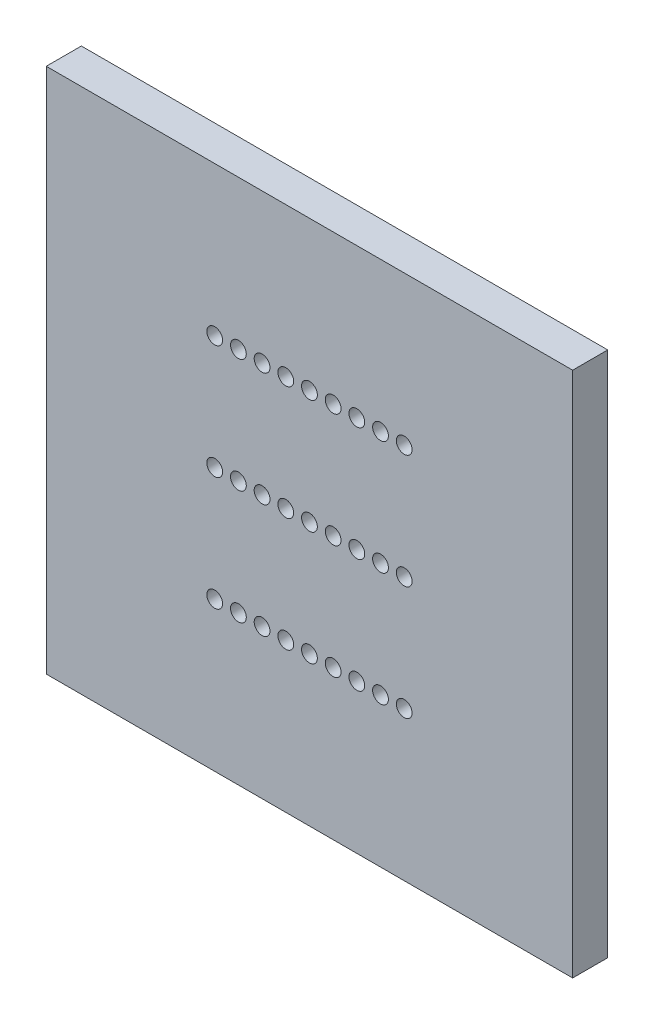
from build123d import *

# Parameters (mm, degrees)
ESQUISSE2_W             = 30
ESQUISSE2_H             = 30
BOSS_EXTRU_1_DEPTH      = 2
ESQUISSE3_R             = 0.45
ENL_V_MAT_EXTRU_1_DEPTH = 10


with BuildPart() as part:
    # Esquisse2 → Boss.-Extru.1 (new body)
    with BuildSketch(Plane.XY):
        Rectangle(ESQUISSE2_W, ESQUISSE2_H)
    extrude(amount=BOSS_EXTRU_1_DEPTH)

    # Esquisse3 → Enlèv. mat.-Extru.1 (cut)
    with BuildSketch(Plane.XY.offset(2)):
        with Locations((-5.4, -6.5)):
            Circle(ESQUISSE3_R)
        with Locations((-5.4, 0)):
            Circle(ESQUISSE3_R)
        with Locations((-5.4, 6.5)):
            Circle(ESQUISSE3_R)
        with Locations((-4.05, -6.5)):
            Circle(ESQUISSE3_R)
        with Locations((-4.05, 0)):
            Circle(ESQUISSE3_R)
        with Locations((-4.05, 6.5)):
            Circle(ESQUISSE3_R)
        with Locations((-2.7, -6.5)):
            Circle(ESQUISSE3_R)
        with Locations((-2.7, 0)):
            Circle(ESQUISSE3_R)
        with Locations((-2.7, 6.5)):
            Circle(ESQUISSE3_R)
        with Locations((-1.35, -6.5)):
            Circle(ESQUISSE3_R)
        with Locations((-1.35, 0)):
            Circle(ESQUISSE3_R)
        with Locations((-1.35, 6.5)):
            Circle(ESQUISSE3_R)
        with Locations((0, -6.5)):
            Circle(ESQUISSE3_R)
        Circle(ESQUISSE3_R)
        with Locations((0, 6.5)):
            Circle(ESQUISSE3_R)
        with Locations((1.35, -6.5)):
            Circle(ESQUISSE3_R)
        with Locations((1.35, 0)):
            Circle(ESQUISSE3_R)
        with Locations((1.35, 6.5)):
            Circle(ESQUISSE3_R)
        with Locations((2.7, -6.5)):
            Circle(ESQUISSE3_R)
        with Locations((2.7, 0)):
            Circle(ESQUISSE3_R)
        with Locations((2.7, 6.5)):
            Circle(ESQUISSE3_R)
        with Locations((4.05, -6.5)):
            Circle(ESQUISSE3_R)
        with Locations((4.05, 0)):
            Circle(ESQUISSE3_R)
        with Locations((4.05, 6.5)):
            Circle(ESQUISSE3_R)
        with Locations((5.4, -6.5)):
            Circle(ESQUISSE3_R)
        with Locations((5.4, 0)):
            Circle(ESQUISSE3_R)
        with Locations((5.4, 6.5)):
            Circle(ESQUISSE3_R)
    extrude(amount=-ENL_V_MAT_EXTRU_1_DEPTH, mode=Mode.SUBTRACT)


solid = part.part
